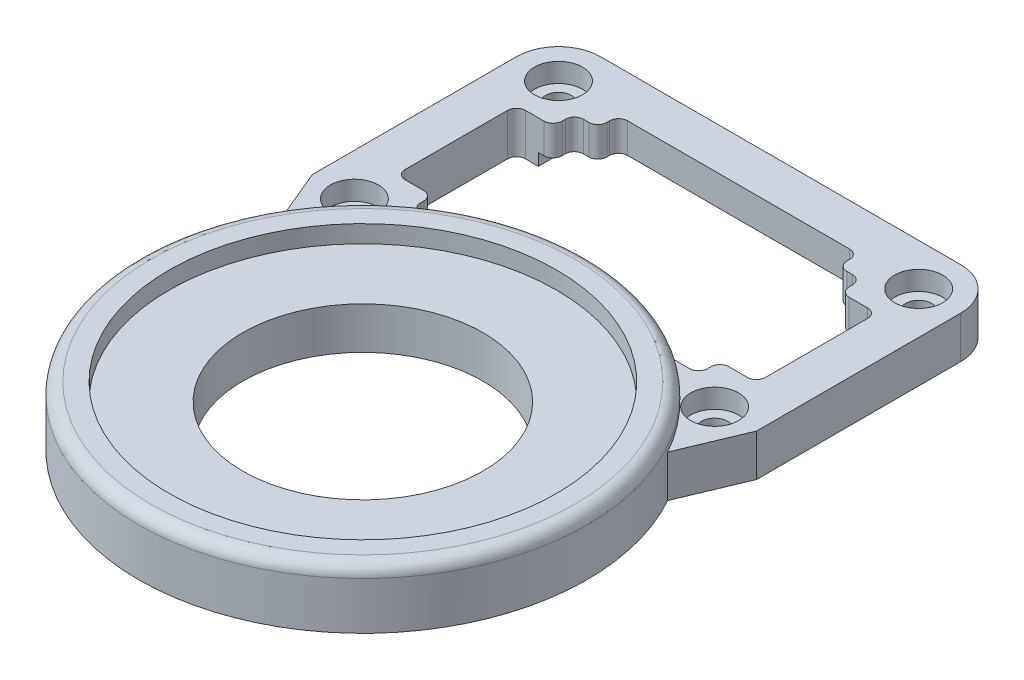
from build123d import *

# Parameters (mm, degrees)
SKETCH1_R                                        = 10
SKETCH1_R_2                                      = 1.1
BOSS_EXTRUDE1_DEPTH                              = 3.5
BOSS_EXTRUDE2_START                              = -3.5
BOSS_EXTRUDE2_DEPTH                              = 3.5
SKETCH8_R                                        = 16.129
BOSS_EXTRUDE4_DEPTH                              = 1.453
SKETCH9_W                                        = 26.35135
SKETCH9_H                                        = 1
CUT_EXTRUDE1_DEPTH                               = 23.2
CBORE_FOR_M2_HEX_HEAD_MACHINE_SCREW1_D           = 2.1
CBORE_FOR_M2_HEX_HEAD_MACHINE_SCREW1_DEPTH       = 3.5
CBORE_FOR_M2_HEX_HEAD_MACHINE_SCREW1_CBORE_D     = 4
CBORE_FOR_M2_HEX_HEAD_MACHINE_SCREW1_CBORE_DEPTH = 1.6
FILLET1_R                                        = 0.75
FILLET2_R                                        = 1


# Read off the part's stored shape, not the designer's step: Boss-Extrude2
with BuildPart() as part:
    # Sketch1 → Boss-Extrude1 (new body)
    with BuildSketch(Plane(origin=(0, 0, 0), x_dir=(1, 0, 0), z_dir=(0, 1, 0))):
        with BuildLine():
            Line((-18.5013, 8.509), (-18.5013, -8.491))
            Line((-18.5013, -8.491), (-15.0013, -16.862708425))
            ThreePointArc((-15.0013, -16.862708425), (0, -38.916709632), (15.0013, -16.862708425))
            Line((15.0013, -16.862708425), (18.4987, -8.491))
            Line((18.4987, -8.491), (18.4987, 8.509))
            ThreePointArc((18.4987, 8.509), (17.473573734, 10.983873734), (14.9987, 12.009))
            Line((14.9987, 12.009), (-15.0013, 12.009))
            ThreePointArc((-15.0013, 12.009), (-17.476173734, 10.983873734), (-18.5013, 8.509))
        make_face()
        with Locations(Location((0, -22.787709632, 0), (0, 0, 270))):
            Circle(SKETCH1_R, mode=Mode.SUBTRACT)
        with Locations(Location((-15.0013, 8.509, 0), (0, 0, 270))):
            Circle(SKETCH1_R_2, mode=Mode.SUBTRACT)
        with Locations(Location((-15.0013, -8.491, 0), (0, 0, 270))):
            Circle(SKETCH1_R_2, mode=Mode.SUBTRACT)
        with Locations(Location((14.9987, 8.509, 0), (0, 0, 270))):
            Circle(SKETCH1_R_2, mode=Mode.SUBTRACT)
        with Locations(Location((14.9987, -8.491, 0), (0, 0, 270))):
            Circle(SKETCH1_R_2, mode=Mode.SUBTRACT)
        Polygon((-11.95622235, -6.783455998), (11.95622235, -6.783455998), (11.95622235, -5.009), (15.0013, -5.009), (15.0013, 5.009), (11.95622235, 5.009), (11.95622235, 6.783455998), (9.9987, 6.783455998), (9.9987, 8.509), (-9.9987, 8.509), (-9.9987, 6.783455998), (-11.95622235, 6.783455998), (-11.95622235, 5.009), (-15.0013, 5.009), (-15.0013, -5.009), (-11.95622235, -5.009), align=None, mode=Mode.SUBTRACT)
    extrude(amount=BOSS_EXTRUDE1_DEPTH)

    # Boss-Extrude2 outline → Boss-Extrude2 (add)
    with BuildSketch(Plane(origin=(0, 3.5, 0), x_dir=(1, 0, 0), z_dir=(0, 1, 0)).offset(BOSS_EXTRUDE2_START)):
        with BuildLine():
            Line((-15.0013, -16.862708425), (-16.316803416, -13.716133844))
            ThreePointArc((-16.316803416, -13.716133844), (0.000574122, -41.456709624), (16.316245434, -13.71513029))
            Line((16.316245434, -13.71513029), (15.0013, -16.862708425))
            ThreePointArc((15.0013, -16.862708425), (0, -38.916709632), (-15.0013, -16.862708425))
        make_face()
        with BuildLine():
            Line((-9.612253982, -6.783455998), (9.612253982, -6.783455998))
            ThreePointArc((9.612253982, -6.783455998), (0, -4.118709632), (-9.612253982, -6.783455998))
        make_face()
    extrude(amount=BOSS_EXTRUDE2_DEPTH)

    # Sketch8 → Boss-Extrude4 (add)
    with BuildSketch(Plane(origin=(0, 3.5, 0), x_dir=(1, 0, 0), z_dir=(0, 1, 0))):
        with BuildLine():
            ThreePointArc((-16.316803416, -13.716133844), (-4.685784781, -40.859095356), (18.669, -22.787709632))
            ThreePointArc((18.669, -22.787709632), (18.071241615, -18.10136911), (16.316245434, -13.71513029))
            ThreePointArc((16.316245434, -13.71513029), (13.419530454, -9.808966882), (9.612253982, -6.783455998))
            ThreePointArc((9.612253982, -6.783455998), (0, -4.118709632), (-9.612253982, -6.783455998))
            ThreePointArc((-9.612253982, -6.783455998), (-13.419929579, -9.809379575), (-16.316803416, -13.716133844))
        make_face()
        with Locations(Location((0, -22.787709632, 0), (0, 0, 90))):
            Circle(SKETCH8_R, mode=Mode.SUBTRACT)
    extrude(amount=BOSS_EXTRUDE4_DEPTH)

    # Sketch9 → Cut-Extrude1 (cut)
    with BuildSketch(Plane(origin=(0, 0, -12.009), x_dir=(-1, 0, 0), z_dir=(0, 0, -1))):
        with Locations((0, 0.5)):
            Rectangle(SKETCH9_W, SKETCH9_H)
    extrude(amount=-CUT_EXTRUDE1_DEPTH, mode=Mode.SUBTRACT)

    # CBORE for M2 Hex Head Machine Screw1
    with Locations(Plane(origin=(0, 3.5, 0), x_dir=(1, 0, 0), z_dir=(0, 1, 0))):
        with Locations((-15.0013, 8.509), (14.9987, 8.509), (14.9987, -8.491), (-15.0013, -8.491)):
            CounterBoreHole(CBORE_FOR_M2_HEX_HEAD_MACHINE_SCREW1_D / 2, CBORE_FOR_M2_HEX_HEAD_MACHINE_SCREW1_CBORE_D / 2, CBORE_FOR_M2_HEX_HEAD_MACHINE_SCREW1_CBORE_DEPTH, depth=CBORE_FOR_M2_HEX_HEAD_MACHINE_SCREW1_DEPTH)

    # Fillet1
    fillet1_edges = [part.edges().sort_by_distance(p)[0] for p in [
        (9.9987, 2.25, -8.509),
        (-9.9987, 2.25, -8.509),
        (-9.9987, 2.25, -6.783455998),
        (-11.95622235, 2.25, -6.783455998),
        (-11.95622235, 2.25, -5.009),
        (-15.0013, 1.75, -5.009),
        (-15.0013, 1.75, 5.009),
        (-11.95622235, 2.25, 5.009),
        (-11.95622235, 2.25, 6.783455998),
        (11.95622235, 2.25, 6.783455998),
        (11.95622235, 2.25, 5.009),
        (15.0013, 1.75, 5.009),
        (15.0013, 1.75, -5.009),
        (11.95622235, 2.25, -5.009),
        (11.95622235, 2.25, -6.783455998),
        (9.9987, 2.25, -6.783455998),
    ]]
    fillet(fillet1_edges, radius=FILLET1_R)

    # Fillet2
    fillet2_edges = [part.edges().sort_by_distance(p)[0] for p in [
        (-18.669, 4.953, 22.787709632),
    ]]
    fillet(fillet2_edges, radius=FILLET2_R)


solid = part.part
